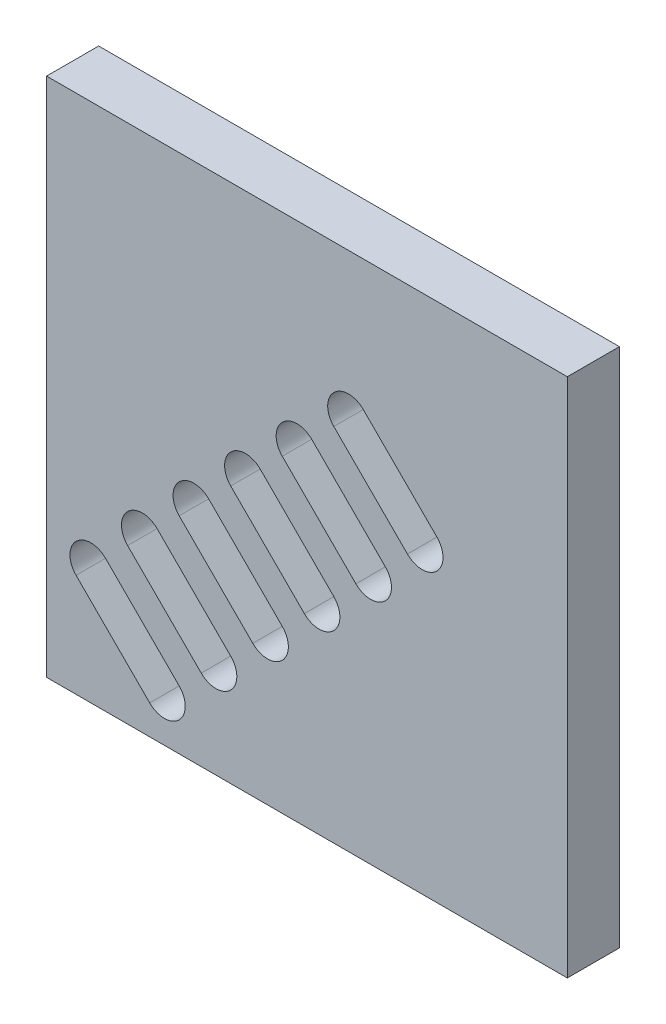
from build123d import *

# Parameters (mm, degrees)
SKETCH1_W           = 100
SKETCH1_H           = 100
BOSS_EXTRUDE1_DEPTH = 5
LPATTERN2_START     = -5
LPATTERN2_DEPTH     = 10


# Read off the part's stored shape, not the designer's step: LPattern2
with BuildPart() as part:
    # Sketch1 → Boss-Extrude1 (new, symmetric)
    with BuildSketch(Plane.XY):
        Rectangle(SKETCH1_W, SKETCH1_H)
        with BuildLine():
            Line((-38.686291501, -24.544155877), (-24.544155877, -38.686291501))
            ThreePointArc((-24.544155877, -38.686291501), (-24.544155877, -44.343145751), (-30.201010127, -44.343145751))
            Line((-30.201010127, -44.343145751), (-44.343145751, -30.201010127))
            ThreePointArc((-44.343145751, -30.201010127), (-44.343145751, -24.544155877), (-38.686291501, -24.544155877))
        make_face(mode=Mode.SUBTRACT)
    extrude(amount=BOSS_EXTRUDE1_DEPTH, both=True)

    # LPattern2 outline → LPattern2 (cut)
    with BuildSketch(Plane.XY.offset(LPATTERN2_START)):
        with BuildLine():
            Line((24.953318806, 10.811183182), (10.811183182, 24.953318806))
            ThreePointArc((10.811183182, 24.953318806), (5.154328933, 24.953318806), (5.154328933, 19.296464556))
            Line((5.154328933, 19.296464556), (19.296464556, 5.154328933))
            ThreePointArc((19.296464556, 5.154328933), (24.953318806, 5.154328933), (24.953318806, 10.811183182))
        make_face()
        with BuildLine():
            Line((15.053823869, 0.911688245), (0.911688245, 15.053823869))
            ThreePointArc((0.911688245, 15.053823869), (-4.745166004, 15.053823869), (-4.745166004, 9.39696962))
            Line((-4.745166004, 9.39696962), (9.39696962, -4.745166004))
            ThreePointArc((9.39696962, -4.745166004), (15.053823869, -4.745166004), (15.053823869, 0.911688245))
        make_face()
        with BuildLine():
            Line((5.154328933, -8.987806691), (-8.987806691, 5.154328933))
            ThreePointArc((-8.987806691, 5.154328933), (-14.644660941, 5.154328933), (-14.644660941, -0.502525317))
            Line((-14.644660941, -0.502525317), (-0.502525317, -14.644660941))
            ThreePointArc((-0.502525317, -14.644660941), (5.154328933, -14.644660941), (5.154328933, -8.987806691))
        make_face()
        with BuildLine():
            Line((-4.745166004, -18.887301628), (-18.887301628, -4.745166004))
            ThreePointArc((-18.887301628, -4.745166004), (-24.544155877, -4.745166004), (-24.544155877, -10.402020254))
            Line((-24.544155877, -10.402020254), (-10.402020254, -24.544155877))
            ThreePointArc((-10.402020254, -24.544155877), (-4.745166004, -24.544155877), (-4.745166004, -18.887301628))
        make_face()
        with BuildLine():
            Line((-14.644660941, -28.786796564), (-28.786796564, -14.644660941))
            ThreePointArc((-28.786796564, -14.644660941), (-34.443650813, -14.64466094), (-34.443650814, -20.30151519))
            Line((-34.443650814, -20.30151519), (-20.30151519, -34.443650814))
            ThreePointArc((-20.30151519, -34.443650814), (-14.64466094, -34.443650813), (-14.644660941, -28.786796564))
        make_face()
    extrude(amount=LPATTERN2_DEPTH, mode=Mode.SUBTRACT)


solid = part.part
